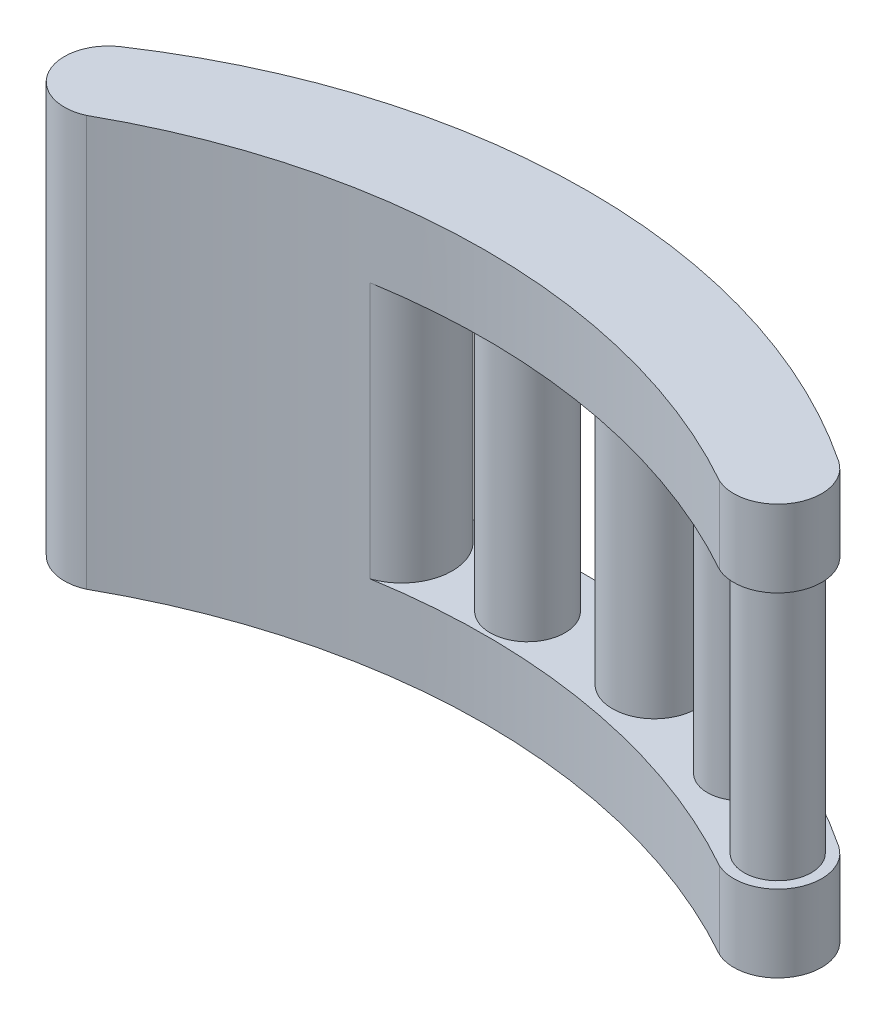
from build123d import *

# Parameters (mm, degrees)
BOSS_EXTRUDE1_DEPTH = 7.5
SKETCH2_R           = 3.280858395
SKETCH2_R_2         = 3.275205085
SKETCH2_R_3         = 4.096949383
SKETCH2_R_4         = 3.647940516
BOSS_EXTRUDE2_DEPTH = 12.5


with BuildPart() as part:
    # Sketch1 → Boss-Extrude1 (new body)
    with BuildSketch(Plane(origin=(0, 0, 0), x_dir=(1, 0, 0), z_dir=(0, 1, 0))):
        with BuildLine():
            ThreePointArc((30.866133755, -7.467902212), (36.371226686, -5.6371486), (35, 0))
            ThreePointArc((35, 0), (0, 10.597147321), (-35, 0))
            ThreePointArc((-35, 0), (-36.371226686, -5.6371486), (-30.866133755, -7.467902212))
            ThreePointArc((-30.866133755, -7.467902212), (-30.558095936, -7.296261243), (-30.249103684, -7.126344474))
            ThreePointArc((-30.249103684, -7.126344474), (0, 0.597147321), (30.249103684, -7.126344474))
            ThreePointArc((30.249103684, -7.126344474), (30.558095936, -7.296261243), (30.866133755, -7.467902212))
        make_face()
    boss_extrude1 = extrude(amount=BOSS_EXTRUDE1_DEPTH)

    # Sketch2 → Boss-Extrude2 (add)
    with BuildSketch(Plane(origin=(0, 7.5, 0), x_dir=(1, 0, 0), z_dir=(0, 1, 0))):
        with Locations((32.624551842, -3.563172237)):
            Circle(SKETCH2_R)
        with Locations((24.087748408, 1.402325041)):
            Circle(SKETCH2_R_2)
        with Locations((12.370046823, 4.677530126)):
            Circle(SKETCH2_R_3)
        with Locations((0, 4.677530126)):
            Circle(SKETCH2_R_4)
        with BuildLine():
            ThreePointArc((-10.409772358, -0.267479246), (-7.23184853, 5.646898526), (-12.886227765, 9.267265878))
            ThreePointArc((-12.886227765, 9.267265878), (-24.387358541, 5.693700204), (-35, 0))
            ThreePointArc((-35, 0), (-36.371226686, -5.6371486), (-30.866133755, -7.467902212))
            ThreePointArc((-30.866133755, -7.467902212), (-20.949621216, -2.98224323), (-10.409772358, -0.267479246))
        make_face()
    boss_extrude2 = extrude(amount=BOSS_EXTRUDE2_DEPTH)

    # Mirror1: Boss-Extrude1, Boss-Extrude2 across plane
    add(boss_extrude1.mirror(Plane.ZX.offset(20)))
    add(boss_extrude2.mirror(Plane.ZX.offset(20)))


solid = part.part
